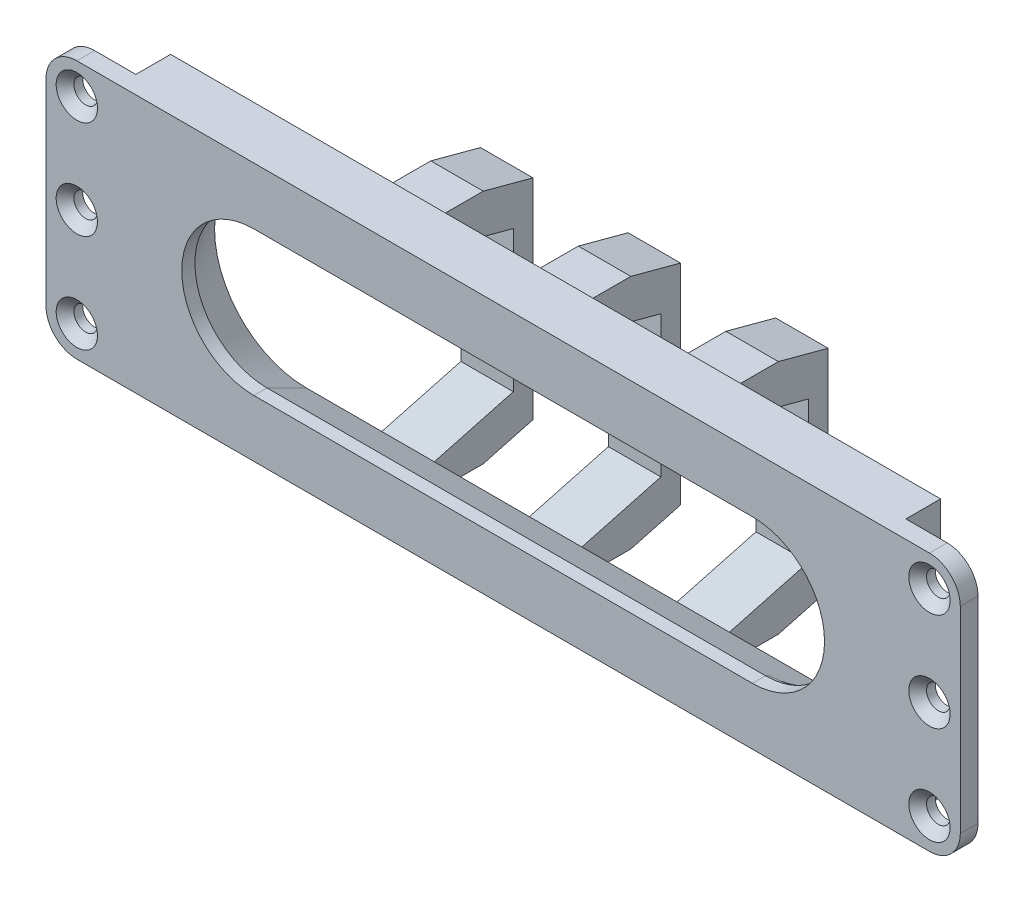
from build123d import *

# Parameters (mm, degrees)
SKETCH1_W                = 118
SKETCH1_H                = 40
SKETCH1_W_2              = 11
BOSS_EXTRUDE1_DEPTH      = 3
BOSS_EXTRUDE2_START      = -5
SKETCH1_3_W              = 118
SKETCH1_3_H              = 40
BOSS_EXTRUDE2_DEPTH      = 5
FILLET1_R                = 5
CHAMFER1_SIZE            = 3
CHAMFER1_SIZE2           = 6
BOSS_EXTRUDE3_DEPTH      = 4
LPATTERN1_COUNT          = 2
LPATTERN1_PITCH          = 22.5
LPATTERN1_COL_COUNT      = 2
LPATTERN1_COL_PITCH      = 22.5
M3_CLEARANCE_HOLE1_D     = 3.6
M3_CLEARANCE_HOLE1_DEPTH = 9
M3_CLEARANCE_HOLE1_TIP   = 1.081549114
SKETCH9_W                = 53
SKETCH9_H                = 2
CUT_EXTRUDE1_DEPTH       = 75.34044996
CUT_EXTRUDE2_DEPTH       = 77.362965502
SKETCH12_W               = 5
SKETCH12_H               = 39.4
CUT_EXTRUDE3_DEPTH       = 0.3
SKETCH13_W               = 5
SKETCH13_H               = 39.4
CUT_EXTRUDE4_DEPTH       = 0.3
CUT_EXTRUDE5_START       = -0.3
CUT_EXTRUDE5_DEPTH       = 0.3
CUT_EXTRUDE6_DEPTH       = 30


# Read off the part's stored shape, not the designer's step: CSK for M3 Flat Head Machine Screw1
with BuildPart() as part:
    # Sketch1 → Boss-Extrude1 (new body)
    # profile 1 of 3: a face of its own
    with BuildSketch(Plane.XY):
        Rectangle(SKETCH1_W, SKETCH1_H)
        with BuildLine():
            ThreePointArc((-38, -11), (-49, 0), (-38, 11))
            Line((-38, 11), (38, 11))
            ThreePointArc((38, 11), (49, 0), (38, -11))
            Line((38, -11), (-38, -11))
        make_face(mode=Mode.SUBTRACT)
    # profile 2 of 3: a face of its own
    with BuildSketch(Plane.XY):
        with Locations((-64.5, 0)):
            Rectangle(SKETCH1_W_2, SKETCH1_H)
    # profile 3 of 3: a face of its own
    with BuildSketch(Plane.XY):
        with Locations((64.5, 0)):
            Rectangle(SKETCH1_W_2, SKETCH1_H)
    extrude(amount=BOSS_EXTRUDE1_DEPTH)

    # Sketch1<3> → Boss-Extrude2 (add)
    with BuildSketch(Plane.XY.offset(BOSS_EXTRUDE2_START)):
        Rectangle(SKETCH1_3_W, SKETCH1_3_H)
        with BuildLine():
            ThreePointArc((-38, -11), (-49, 0), (-38, 11))
            Line((-38, 11), (38, 11))
            ThreePointArc((38, 11), (49, 0), (38, -11))
            Line((38, -11), (-38, -11))
        make_face(mode=Mode.SUBTRACT)
    extrude(amount=BOSS_EXTRUDE2_DEPTH)

    # CSK for M3 Flat Head Machine Screw1 outl → CSK for M3 Flat Head Machine Screw1 (revolve, cut)
    with BuildSketch(Plane(origin=(65, 0, 0), x_dir=(1, 0, 0), z_dir=(0, -1, 0))):
        Polygon((0, 0), (1.8, 0), (1.8, 1.65), (3.15, 3), (0, 3), align=None)
    revolve(axis=Axis((65, 0, 0), (0, 0, 1)), mode=Mode.SUBTRACT)

    # CSK for M3 Flat Head Machine Screw1 2 ou → CSK for M3 Flat Head Machine Screw1 2 (revolve, cut)
    with BuildSketch(Plane(origin=(-65, 0, 0), x_dir=(1, 0, 0), z_dir=(0, -1, 0))):
        Polygon((0, 0), (1.8, 0), (1.8, 1.65), (3.15, 3), (0, 3), align=None)
    revolve(axis=Axis((-65, 0, 0), (0, 0, 1)), mode=Mode.SUBTRACT)

    # CSK for M3 Flat Head Machine Screw1 3 ou → CSK for M3 Flat Head Machine Screw1 3 (revolve, cut)
    with BuildSketch(Plane(origin=(-65, -15, 0), x_dir=(1, 0, 0), z_dir=(0, -1, 0))):
        Polygon((0, 0), (1.8, 0), (1.8, 1.65), (3.15, 3), (0, 3), align=None)
    revolve(axis=Axis((-65, -15, 0), (0, 0, 1)), mode=Mode.SUBTRACT)

    # CSK for M3 Flat Head Machine Screw1 4 ou → CSK for M3 Flat Head Machine Screw1 4 (revolve, cut)
    with BuildSketch(Plane(origin=(65, 15, 0), x_dir=(1, 0, 0), z_dir=(0, -1, 0))):
        Polygon((0, 0), (1.8, 0), (1.8, 1.65), (3.15, 3), (0, 3), align=None)
    revolve(axis=Axis((65, 15, 0), (0, 0, 1)), mode=Mode.SUBTRACT)

    # CSK for M3 Flat Head Machine Screw1 5 ou → CSK for M3 Flat Head Machine Screw1 5 (revolve, cut)
    with BuildSketch(Plane(origin=(65, -15, 0), x_dir=(1, 0, 0), z_dir=(0, -1, 0))):
        Polygon((0, 0), (1.8, 0), (1.8, 1.65), (3.15, 3), (0, 3), align=None)
    revolve(axis=Axis((65, -15, 0), (0, 0, 1)), mode=Mode.SUBTRACT)

    # CSK for M3 Flat Head Machine Screw1 6 ou → CSK for M3 Flat Head Machine Screw1 6 (revolve, cut)
    with BuildSketch(Plane(origin=(-65, 15, 0), x_dir=(1, 0, 0), z_dir=(0, -1, 0))):
        Polygon((0, 0), (1.8, 0), (1.8, 1.65), (3.15, 3), (0, 3), align=None)
    revolve(axis=Axis((-65, 15, 0), (0, 0, 1)), mode=Mode.SUBTRACT)

    # Fillet1
    fillet1_edges = [part.edges().sort_by_distance(p)[0] for p in [
        (-70, -20, 1.5),
        (-70, 20, 1.5),
        (70, 20, 1.5),
        (70, -20, 1.5),
    ]]
    fillet(fillet1_edges, radius=FILLET1_R)

    # Chamfer1
    chamfer1_edges = [part.edges().sort_by_distance(p)[0] for p in [
        (0, 11, -5),
        (49, 0, -5),
        (-49, 0, -5),
        (0, -11, -5),
    ]]
    chamfer1_side = [part.faces().sort_by_distance(p)[0] for p in [
        (0, 18.75404655, -5),
    ]]
    chamfer(chamfer1_edges, length=CHAMFER1_SIZE, length2=CHAMFER1_SIZE2, reference=chamfer1_side[0])

    # Sketch5 → Boss-Extrude3 (add, symmetric)
    with BuildSketch(Plane(origin=(0, 0, 0), x_dir=(0, 0, -1), z_dir=(1, 0, 0))):
        Polygon((5, -14), (5, -20), (20.050000007, -15.967364652), (20.050000007, 15.967364652), (5, 20), (5, 14), (17.050000007, 10.771212229), (17.050000007, -10.771212229), align=None)
    boss_extrude3 = extrude(amount=BOSS_EXTRUDE3_DEPTH, both=True)

    # LPattern1: Boss-Extrude3 ×2
    with Locations(*[(i * LPATTERN1_PITCH, 0, 0) for i in range(1, LPATTERN1_COUNT)]):
        add(boss_extrude3)

    # LPattern1 col: Boss-Extrude3 ×2
    with Locations(*[(-i * LPATTERN1_COL_PITCH, 0, 0) for i in range(1, LPATTERN1_COL_COUNT)]):
        add(boss_extrude3)

    # M3 Clearance Hole1
    with Locations(Plane(origin=(0, 0, -20.050000007), x_dir=(-1, 0, 0), z_dir=(0, 0, -1))):
        with Locations((-22.5, 0), (22.5, 0)):
            Hole(M3_CLEARANCE_HOLE1_D / 2, depth=M3_CLEARANCE_HOLE1_DEPTH)
            with Locations((0, 0, -(M3_CLEARANCE_HOLE1_DEPTH + M3_CLEARANCE_HOLE1_TIP / 2))):  # 118° drill point
                Cone(0, M3_CLEARANCE_HOLE1_D / 2, M3_CLEARANCE_HOLE1_TIP, mode=Mode.SUBTRACT)

    # Sketch9 → Cut-Extrude1 (cut, through all)
    with BuildSketch(Plane(origin=(0, 0, -5), x_dir=(-1, 0, 0), z_dir=(0, 0, -1))):
        with Locations((0, 19)):
            Rectangle(SKETCH9_W, SKETCH9_H)
        with Locations((0, -19)):
            Rectangle(SKETCH9_W, SKETCH9_H)
    extrude(amount=CUT_EXTRUDE1_DEPTH, mode=Mode.SUBTRACT)

    # Sketch10 → Cut-Extrude2 (cut, through all)
    with BuildSketch(Plane.XY.offset(3)):
        with BuildLine():
            Line((70, -15), (70, 15))
            ThreePointArc((70, 15), (68.535533906, 18.535533906), (65, 20))
            Line((65, 20), (-65, 20))
            ThreePointArc((-65, 20), (-68.535533906, 18.535533906), (-70, 15))
            Line((-70, 15), (-70, -15))
            ThreePointArc((-70, -15), (-68.535533906, -18.535533906), (-65, -20))
            Line((-65, -20), (65, -20))
            ThreePointArc((65, -20), (68.535533906, -18.535533906), (70, -15))
        make_face()
        with BuildLine():
            Line((69.7, -15), (69.7, 15))
            ThreePointArc((69.7, 15), (68.323401872, 18.323401872), (65, 19.7))
            Line((65, 19.7), (-65, 19.7))
            ThreePointArc((-65, 19.7), (-68.323401872, 18.323401872), (-69.7, 15))
            Line((-69.7, 15), (-69.7, -15))
            ThreePointArc((-69.7, -15), (-68.323401872, -18.323401872), (-65, -19.7))
            Line((-65, -19.7), (65, -19.7))
            ThreePointArc((65, -19.7), (68.323401872, -18.323401872), (69.7, -15))
        make_face(mode=Mode.SUBTRACT)
    extrude(amount=-CUT_EXTRUDE2_DEPTH, mode=Mode.SUBTRACT)

    # Sketch12 → Cut-Extrude3 (cut)
    with BuildSketch(Plane(origin=(59, 0, 0), x_dir=(0, 0, -1), z_dir=(1, 0, 0))):
        with Locations((2.5, 0)):
            Rectangle(SKETCH12_W, SKETCH12_H)
    extrude(amount=-CUT_EXTRUDE3_DEPTH, mode=Mode.SUBTRACT)

    # Sketch13 → Cut-Extrude4 (cut)
    with BuildSketch(Plane.ZY.offset(59)):
        with Locations((-2.5, 0)):
            Rectangle(SKETCH13_W, SKETCH13_H)
    extrude(amount=-CUT_EXTRUDE4_DEPTH, mode=Mode.SUBTRACT)

    # Sketch14 → Cut-Extrude5 (cut)
    with BuildSketch(Plane(origin=(0, 0, 0), x_dir=(-1, 0, 0), z_dir=(0, 0, -1)).offset(CUT_EXTRUDE5_START)):
        with BuildLine():
            Line((-65, -19.7), (-58.7, -19.7))
            Line((-58.7, -19.7), (-58.7, 19.7))
            Line((-58.7, 19.7), (-65, 19.7))
            ThreePointArc((-65, 19.7), (-68.323401872, 18.323401872), (-69.7, 15))
            Line((-69.7, 15), (-69.7, -15))
            ThreePointArc((-69.7, -15), (-68.323401872, -18.323401872), (-65, -19.7))
        make_face()
        with BuildLine():
            Line((58.7, -19.7), (65, -19.7))
            ThreePointArc((65, -19.7), (68.323401872, -18.323401872), (69.7, -15))
            Line((69.7, -15), (69.7, 15))
            ThreePointArc((69.7, 15), (68.323401872, 18.323401872), (65, 19.7))
            Line((65, 19.7), (58.7, 19.7))
            Line((58.7, 19.7), (58.7, -19.7))
        make_face()
    extrude(amount=CUT_EXTRUDE5_DEPTH, mode=Mode.SUBTRACT)

    # Sketch15 → Cut-Extrude6 (cut)
    with BuildSketch(Plane(origin=(58.7, 0, 0), x_dir=(0, 0, -1), z_dir=(1, 0, 0))):
        Polygon((-0.3, -11.35), (5, -14), (5, 14), (-0.3, 11.35), align=None)
    extrude(amount=-CUT_EXTRUDE6_DEPTH, mode=Mode.SUBTRACT)


solid = part.part
